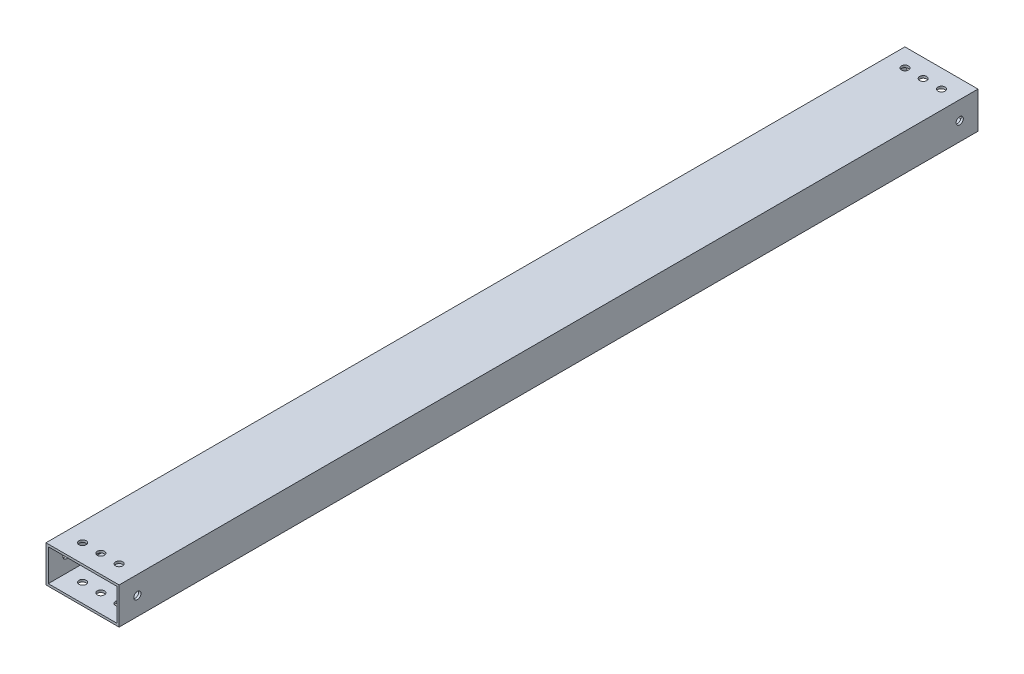
from build123d import *

# Parameters (mm, degrees)
SKETCH1_W           = 50.8
SKETCH1_H           = 25.4
BOSS_EXTRUDE1_DEPTH = 298.45
SHELL1_T            = -1.5875
SKETCH2_R           = 2.4892
CUT_EXTRUDE1_DEPTH  = 304.806192333
SKETCH3_R           = 2.4892
CUT_EXTRUDE2_DEPTH  = 304.806192333


with BuildPart() as part:
    # Sketch1 → Boss-Extrude1 (new, symmetric)
    with BuildSketch(Plane.XY):
        with Locations((25.4, 12.7)):
            Rectangle(SKETCH1_W, SKETCH1_H)
    extrude(amount=BOSS_EXTRUDE1_DEPTH, both=True)

    # Shell1
    shell1_openings = [part.faces().sort_by_distance(p)[0] for p in [
        (25.4, 12.7, -298.45),
        (25.4, 12.7, 298.45),
    ]]
    offset(amount=SHELL1_T, openings=shell1_openings, kind=Kind.INTERSECTION)

    # Sketch2 → Cut-Extrude1 (cut, through all)
    with BuildSketch(Plane(origin=(0, 25.4, 0), x_dir=(1, 0, 0), z_dir=(0, 1, 0))):
        with Locations((38.1, -285.75)):
            Circle(SKETCH2_R)
        with Locations((25.4, -285.75)):
            Circle(SKETCH2_R)
        with Locations((12.7, -285.75)):
            Circle(SKETCH2_R)
    cut_extrude1 = extrude(amount=-CUT_EXTRUDE1_DEPTH, mode=Mode.SUBTRACT)

    # Sketch3 → Cut-Extrude2 (cut, through all)
    with BuildSketch(Plane(origin=(50.8, 0, 0), x_dir=(0, 0, -1), z_dir=(1, 0, 0))):
        with Locations((-285.75, 12.7)):
            Circle(SKETCH3_R)
    cut_extrude2 = extrude(amount=-CUT_EXTRUDE2_DEPTH, mode=Mode.SUBTRACT)

    # Mirror1: Cut-Extrude1, Cut-Extrude2 across plane
    add(cut_extrude1.mirror(Plane.XY), mode=Mode.SUBTRACT)
    add(cut_extrude2.mirror(Plane.XY), mode=Mode.SUBTRACT)


solid = part.part
